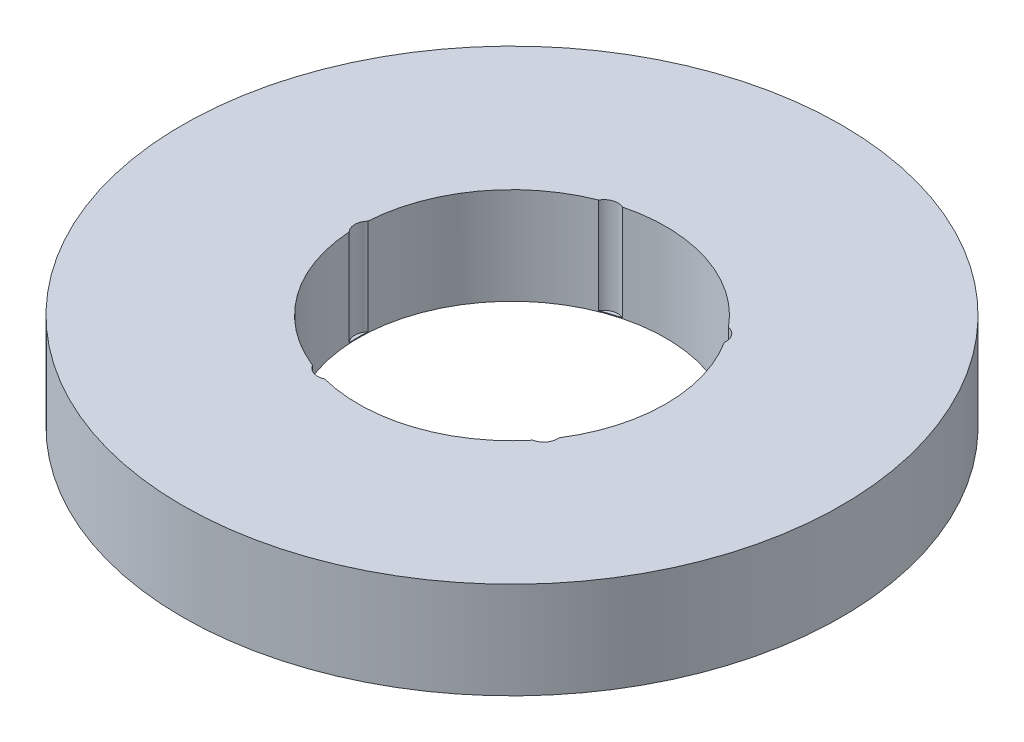
from build123d import *

# Parameters (mm, degrees)
SKETCH1_R           = 75
BOSS_EXTRUDE1_DEPTH = 22
SKETCH2_R           = 35
CUT_EXTRUDE1_DEPTH  = 109.323589305
SKETCH3_R           = 3.17399697
CUT_EXTRUDE2_DEPTH  = 21.832550038
CIRPATTERN1_COUNT   = 5


with BuildPart() as part:
    # Sketch1 → Boss-Extrude1 (new body)
    with BuildSketch(Plane(origin=(0, 0, 0), x_dir=(1, 0, 0), z_dir=(0, 1, 0))):
        Circle(SKETCH1_R)
    extrude(amount=BOSS_EXTRUDE1_DEPTH)

    # Sketch2 → Cut-Extrude1 (cut, through all)
    with BuildSketch(Plane(origin=(0, 0, 0), x_dir=(1, 0, 0), z_dir=(0, 1, 0))):
        Circle(SKETCH2_R)
    extrude(amount=CUT_EXTRUDE1_DEPTH, mode=Mode.SUBTRACT)

    # Sketch3 → Cut-Extrude2 (cut)
    with BuildSketch(Plane(origin=(0, 22, 0), x_dir=(1, 0, 0), z_dir=(0, 1, 0))):
        with Locations((-32.597740569, 0)):
            Circle(SKETCH3_R)
    cut_extrude2 = extrude(amount=-CUT_EXTRUDE2_DEPTH, mode=Mode.SUBTRACT)

    # CirPattern1: Cut-Extrude2 ×5 about axis
    cirpattern1_axis = Axis((0, 0, 0), (0, 1, 0))
    for i in range(1, CIRPATTERN1_COUNT):
        add(cut_extrude2.rotate(cirpattern1_axis, i * 360 / CIRPATTERN1_COUNT), mode=Mode.SUBTRACT)


solid = part.part
